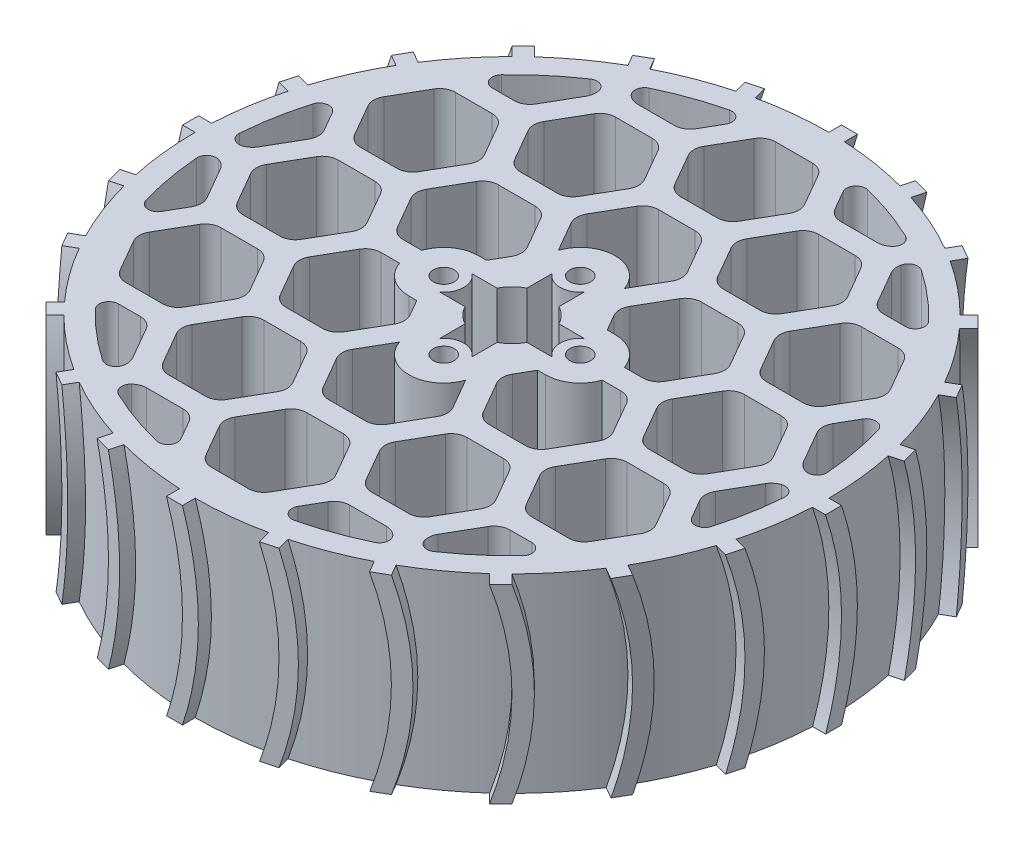
from build123d import *

# Parameters (mm, degrees)
SKETCH3_R           = 100
BOSS_EXTRUDE1_DEPTH = 60
SKETCH3_3_R         = 6.338999989
SKETCH3_3_R_2       = 3.302
BOSS_EXTRUDE2_DEPTH = 60
FILLET2_R           = 3
BOSS_EXTRUDE3_START = -2
BOSS_EXTRUDE3_DEPTH = 6
CIRPATTERN1_COUNT   = 24
SKETCH3_4_R         = 6.338999989
SKETCH3_4_R_2       = 3.302
CUT_EXTRUDE1_DEPTH  = 30


with BuildPart() as part:
    # Sketch3 → Boss-Extrude1 (new body)
    with BuildSketch(Plane(origin=(0, 0, 0), x_dir=(1, 0, 0), z_dir=(0, 1, 0))):
        Circle(SKETCH3_R)
        with BuildLine():
            Line((9.767988863, 5.058299474), (17.727459802, 5.058299474))
            ThreePointArc((17.72745979, 5.05829949), (27.886999941, 1.2e-08), (17.727459809, -5.058299505))
            Line((17.727459783, -5.05829954), (9.767988829, -5.05829954))
            ThreePointArc((9.767988829, -5.05829954), (7.778174567, -7.778174619), (5.058299474, -9.767988863))
            Line((5.058299474, -9.767988863), (5.058299474, -17.727459802))
            ThreePointArc((5.05829949, -17.72745979), (1.2e-08, -27.886999941), (-5.058299505, -17.727459809))
            Line((-5.05829954, -17.727459783), (-5.05829954, -9.767988829))
            ThreePointArc((-5.05829954, -9.767988829), (-7.778174619, -7.778174567), (-9.767988863, -5.058299474))
            Line((-9.767988863, -5.058299474), (-17.727459802, -5.058299474))
            ThreePointArc((-17.72745979, -5.05829949), (-27.886999941, -1.2e-08), (-17.727459809, 5.058299505))
            Line((-17.727459783, 5.05829954), (-9.767988829, 5.05829954))
            ThreePointArc((-9.767988829, 5.05829954), (-7.778174567, 7.778174619), (-5.058299474, 9.767988863))
            Line((-5.058299474, 9.767988863), (-5.058299474, 17.727459802))
            ThreePointArc((-5.05829949, 17.72745979), (-1.2e-08, 27.886999941), (5.058299505, 17.727459809))
            Line((5.05829954, 17.727459783), (5.05829954, 9.767988829))
            ThreePointArc((5.05829954, 9.767988829), (7.778174619, 7.778174567), (9.767988863, 5.058299474))
        make_face(mode=Mode.SUBTRACT)
        with BuildLine():
            ThreePointArc((10.425269447, 25.057096364), (-7e-09, 32.547999916), (-10.425269391, 25.057096268))
            Line((-10.425269391, 25.057096268), (-15.877132403, 34.5))
            ThreePointArc((-15.877132403, 34.5), (-16.547005384, 37), (-15.877132403, 39.5))
            Line((-15.877132403, 39.5), (-10.103629711, 49.5))
            ThreePointArc((-10.103629711, 49.5), (-8.273502692, 51.330127019), (-5.773502692, 52))
            Line((-5.773502692, 52), (5.773502692, 52))
            ThreePointArc((5.773502692, 52), (8.273502692, 51.330127019), (10.103629711, 49.5))
            Line((10.103629711, 49.5), (15.877132403, 39.5))
            ThreePointArc((15.877132403, 39.5), (16.547005384, 37), (15.877132403, 34.5))
            Line((15.877132403, 34.5), (10.425269447, 25.057096364))
        make_face(mode=Mode.SUBTRACT)
        with BuildLine():
            ThreePointArc((86.025190109, 31), (86.543723708, 31.736009208), (87.185842375, 32.367095782))
            ThreePointArc((87.185842375, 32.367095782), (91.209249511, 18.162400823), (92.934116448, 3.5))
            Line((92.934116448, 3.5), (90.355317128, 3.5))
            ThreePointArc((90.355317128, 3.5), (87.855317128, 4.169872981), (86.025190109, 6))
            Line((86.025190109, 6), (80.251687417, 16))
            ThreePointArc((80.251687417, 16), (79.581814436, 18.5), (80.251687417, 21))
            Line((80.251687417, 21), (86.025190109, 31))
        make_face(mode=Mode.SUBTRACT)
        with BuildLine():
            Line((90.355317128, -3.5), (92.934116448, -3.5))
            ThreePointArc((92.934116448, -3.5), (91.209249511, -18.162400823), (87.185842375, -32.367095782))
            ThreePointArc((87.185842375, -32.367095782), (86.543723707, -31.736009208), (86.025190109, -31))
            Line((86.025190109, -31), (80.251687417, -21))
            ThreePointArc((80.251687417, -21), (79.581814436, -18.5), (80.251687417, -16))
            Line((80.251687417, -16), (86.025190109, -6))
            ThreePointArc((86.025190109, -6), (87.855317128, -4.169872981), (90.355317128, -3.5))
        make_face(mode=Mode.SUBTRACT)
        with BuildLine():
            ThreePointArc((69.859382572, -59), (70.756052043, -59.081058665), (71.623648382, -59.321606456))
            ThreePointArc((71.623648382, -59.321606456), (61.333725262, -69.908326725), (49.498147137, -78.733305722))
            Line((49.498147137, -78.733305722), (48.208747477, -76.5))
            ThreePointArc((48.208747477, -76.5), (47.538874496, -74), (48.208747477, -71.5))
            Line((48.208747477, -71.5), (53.982250169, -61.5))
            ThreePointArc((53.982250169, -61.5), (55.812377188, -59.669872981), (58.312377188, -59))
            Line((58.312377188, -59), (69.859382572, -59))
        make_face(mode=Mode.SUBTRACT)
        with BuildLine():
            Line((42.146569651, -80), (43.435969311, -82.233305722))
            ThreePointArc((43.435969311, -82.233305722), (29.875524249, -88.070727548), (15.562193993, -91.688702238))
            ThreePointArc((15.562193993, -91.688702238), (15.787671665, -90.817067873), (16.165807537, -90))
            Line((16.165807537, -90), (21.939310229, -80))
            ThreePointArc((21.939310229, -80), (23.769437248, -78.169872981), (26.269437248, -77.5))
            Line((26.269437248, -77.5), (37.816442632, -77.5))
            ThreePointArc((37.816442632, -77.5), (40.316442632, -78.169872981), (42.146569651, -80))
        make_face(mode=Mode.SUBTRACT)
        with BuildLine():
            ThreePointArc((-16.165807537, -90), (-15.787671665, -90.817067873), (-15.562193993, -91.688702238))
            ThreePointArc((-15.562193993, -91.688702238), (-29.875524249, -88.070727548), (-43.435969311, -82.233305722))
            Line((-43.435969311, -82.233305722), (-42.146569651, -80))
            ThreePointArc((-42.146569651, -80), (-40.316442632, -78.169872981), (-37.816442632, -77.5))
            Line((-37.816442632, -77.5), (-26.269437248, -77.5))
            ThreePointArc((-26.269437248, -77.5), (-23.769437248, -78.169872981), (-21.939310229, -80))
            Line((-21.939310229, -80), (-16.165807537, -90))
        make_face(mode=Mode.SUBTRACT)
        with BuildLine():
            Line((-48.208747477, -76.5), (-49.498147137, -78.733305722))
            ThreePointArc((-49.498147137, -78.733305722), (-61.333725262, -69.908326725), (-71.623648382, -59.321606456))
            ThreePointArc((-71.623648382, -59.321606456), (-70.756052043, -59.081058665), (-69.859382572, -59))
            Line((-69.859382572, -59), (-58.312377188, -59))
            ThreePointArc((-58.312377188, -59), (-55.812377188, -59.669872981), (-53.982250169, -61.5))
            Line((-53.982250169, -61.5), (-48.208747477, -71.5))
            ThreePointArc((-48.208747477, -71.5), (-47.538874496, -74), (-48.208747477, -76.5))
        make_face(mode=Mode.SUBTRACT)
        with BuildLine():
            ThreePointArc((-86.025190109, -31), (-86.543723708, -31.736009208), (-87.185842375, -32.367095782))
            ThreePointArc((-87.185842375, -32.367095782), (-91.209249511, -18.162400823), (-92.934116448, -3.5))
            Line((-92.934116448, -3.5), (-90.355317128, -3.5))
            ThreePointArc((-90.355317128, -3.5), (-87.855317128, -4.169872981), (-86.025190109, -6))
            Line((-86.025190109, -6), (-80.251687417, -16))
            ThreePointArc((-80.251687417, -16), (-79.581814436, -18.5), (-80.251687417, -21))
            Line((-80.251687417, -21), (-86.025190109, -31))
        make_face(mode=Mode.SUBTRACT)
        with BuildLine():
            Line((-90.355317128, 3.5), (-92.934116448, 3.5))
            ThreePointArc((-92.934116448, 3.5), (-91.209249511, 18.162400823), (-87.185842375, 32.367095782))
            ThreePointArc((-87.185842375, 32.367095782), (-86.543723707, 31.736009208), (-86.025190109, 31))
            Line((-86.025190109, 31), (-80.251687417, 21))
            ThreePointArc((-80.251687417, 21), (-79.581814436, 18.5), (-80.251687417, 16))
            Line((-80.251687417, 16), (-86.025190109, 6))
            ThreePointArc((-86.025190109, 6), (-87.855317128, 4.169872981), (-90.355317128, 3.5))
        make_face(mode=Mode.SUBTRACT)
        with BuildLine():
            ThreePointArc((-69.859382572, 59), (-70.756052043, 59.081058665), (-71.623648382, 59.321606456))
            ThreePointArc((-71.623648382, 59.321606456), (-61.333725262, 69.908326725), (-49.498147137, 78.733305722))
            Line((-49.498147137, 78.733305722), (-48.208747477, 76.5))
            ThreePointArc((-48.208747477, 76.5), (-47.538874496, 74), (-48.208747477, 71.5))
            Line((-48.208747477, 71.5), (-53.982250169, 61.5))
            ThreePointArc((-53.982250169, 61.5), (-55.812377188, 59.669872981), (-58.312377188, 59))
            Line((-58.312377188, 59), (-69.859382572, 59))
        make_face(mode=Mode.SUBTRACT)
        with BuildLine():
            Line((-42.146569651, 80), (-43.435969311, 82.233305722))
            ThreePointArc((-43.435969311, 82.233305722), (-29.875524249, 88.070727548), (-15.562193993, 91.688702238))
            ThreePointArc((-15.562193993, 91.688702238), (-15.787671665, 90.817067873), (-16.165807537, 90))
            Line((-16.165807537, 90), (-21.939310229, 80))
            ThreePointArc((-21.939310229, 80), (-23.769437248, 78.169872981), (-26.269437248, 77.5))
            Line((-26.269437248, 77.5), (-37.816442632, 77.5))
            ThreePointArc((-37.816442632, 77.5), (-40.316442632, 78.169872981), (-42.146569651, 80))
        make_face(mode=Mode.SUBTRACT)
        with BuildLine():
            ThreePointArc((16.165807537, 90), (15.787671665, 90.817067873), (15.562193993, 91.688702238))
            ThreePointArc((15.562193993, 91.688702238), (29.875524249, 88.070727548), (43.435969311, 82.233305722))
            Line((43.435969311, 82.233305722), (42.146569651, 80))
            ThreePointArc((42.146569651, 80), (40.316442632, 78.169872981), (37.816442632, 77.5))
            Line((37.816442632, 77.5), (26.269437248, 77.5))
            ThreePointArc((26.269437248, 77.5), (23.769437248, 78.169872981), (21.939310229, 80))
            Line((21.939310229, 80), (16.165807537, 90))
        make_face(mode=Mode.SUBTRACT)
        with BuildLine():
            Line((48.208747477, 76.5), (49.498147137, 78.733305722))
            ThreePointArc((49.498147137, 78.733305722), (61.333725262, 69.908326725), (71.623648382, 59.321606456))
            ThreePointArc((71.623648382, 59.321606456), (70.756052043, 59.081058665), (69.859382572, 59))
            Line((69.859382572, 59), (58.312377188, 59))
            ThreePointArc((58.312377188, 59), (55.812377188, 59.669872981), (53.982250169, 61.5))
            Line((53.982250169, 61.5), (48.208747477, 71.5))
            ThreePointArc((48.208747477, 71.5), (47.538874496, 74), (48.208747477, 76.5))
        make_face(mode=Mode.SUBTRACT)
        with BuildLine():
            Line((-26.269437248, -70.5), (-37.816442632, -70.5))
            ThreePointArc((-37.816442632, -70.5), (-40.316442632, -69.830127019), (-42.146569651, -68))
            Line((-42.146569651, -68), (-47.920072343, -58))
            ThreePointArc((-47.920072343, -58), (-48.589945324, -55.5), (-47.920072343, -53))
            Line((-47.920072343, -53), (-42.146569651, -43))
            ThreePointArc((-42.146569651, -43), (-40.316442632, -41.169872981), (-37.816442632, -40.5))
            Line((-37.816442632, -40.5), (-26.269437248, -40.5))
            ThreePointArc((-26.269437248, -40.5), (-23.769437248, -41.169872981), (-21.939310229, -43))
            Line((-21.939310229, -43), (-16.165807537, -53))
            ThreePointArc((-16.165807537, -53), (-15.495934556, -55.5), (-16.165807537, -58))
            Line((-16.165807537, -58), (-21.939310229, -68))
            ThreePointArc((-21.939310229, -68), (-23.769437248, -69.830127019), (-26.269437248, -70.5))
        make_face(mode=Mode.SUBTRACT)
        with BuildLine():
            Line((15.877132403, -76.5), (10.103629711, -86.5))
            ThreePointArc((10.103629711, -86.5), (8.273502692, -88.330127019), (5.773502692, -89))
            Line((5.773502692, -89), (-5.773502692, -89))
            ThreePointArc((-5.773502692, -89), (-8.273502692, -88.330127019), (-10.103629711, -86.5))
            Line((-10.103629711, -86.5), (-15.877132403, -76.5))
            ThreePointArc((-15.877132403, -76.5), (-16.547005384, -74), (-15.877132403, -71.5))
            Line((-15.877132403, -71.5), (-10.103629711, -61.5))
            ThreePointArc((-10.103629711, -61.5), (-8.273502692, -59.669872981), (-5.773502692, -59))
            Line((-5.773502692, -59), (5.773502692, -59))
            ThreePointArc((5.773502692, -59), (8.273502692, -59.669872981), (10.103629711, -61.5))
            Line((10.103629711, -61.5), (15.877132403, -71.5))
            ThreePointArc((15.877132403, -71.5), (16.547005384, -74), (15.877132403, -76.5))
        make_face(mode=Mode.SUBTRACT)
        with BuildLine():
            Line((-58.312377188, -52), (-69.859382572, -52))
            ThreePointArc((-69.859382572, -52), (-72.359382572, -51.330127019), (-74.189509591, -49.5))
            Line((-74.189509591, -49.5), (-79.963012283, -39.5))
            ThreePointArc((-79.963012283, -39.5), (-80.632885264, -37), (-79.963012283, -34.5))
            Line((-79.963012283, -34.5), (-74.189509591, -24.5))
            ThreePointArc((-74.189509591, -24.5), (-72.359382572, -22.669872981), (-69.859382572, -22))
            Line((-69.859382572, -22), (-58.312377188, -22))
            ThreePointArc((-58.312377188, -22), (-55.812377188, -22.669872981), (-53.982250169, -24.5))
            Line((-53.982250169, -24.5), (-48.208747477, -34.5))
            ThreePointArc((-48.208747477, -34.5), (-47.538874496, -37), (-48.208747477, -39.5))
            Line((-48.208747477, -39.5), (-53.982250169, -49.5))
            ThreePointArc((-53.982250169, -49.5), (-55.812377188, -51.330127019), (-58.312377188, -52))
        make_face(mode=Mode.SUBTRACT)
        with BuildLine():
            Line((-74.189509591, -12.5), (-79.963012283, -2.5))
            ThreePointArc((-79.963012283, -2.5), (-80.632885264, 0), (-79.963012283, 2.5))
            Line((-79.963012283, 2.5), (-74.189509591, 12.5))
            ThreePointArc((-74.189509591, 12.5), (-72.359382572, 14.330127019), (-69.859382572, 15))
            Line((-69.859382572, 15), (-58.312377188, 15))
            ThreePointArc((-58.312377188, 15), (-55.812377188, 14.330127019), (-53.982250169, 12.5))
            Line((-53.982250169, 12.5), (-48.208747477, 2.5))
            ThreePointArc((-48.208747477, 2.5), (-47.538874496, 0), (-48.208747477, -2.5))
            Line((-48.208747477, -2.5), (-53.982250169, -12.5))
            ThreePointArc((-53.982250169, -12.5), (-55.812377188, -14.330127019), (-58.312377188, -15))
            Line((-58.312377188, -15), (-69.859382572, -15))
            ThreePointArc((-69.859382572, -15), (-72.359382572, -14.330127019), (-74.189509591, -12.5))
        make_face(mode=Mode.SUBTRACT)
        with BuildLine():
            Line((47.920072343, -58), (42.146569651, -68))
            ThreePointArc((42.146569651, -68), (40.316442632, -69.830127019), (37.816442632, -70.5))
            Line((37.816442632, -70.5), (26.269437248, -70.5))
            ThreePointArc((26.269437248, -70.5), (23.769437248, -69.830127019), (21.939310229, -68))
            Line((21.939310229, -68), (16.165807537, -58))
            ThreePointArc((16.165807537, -58), (15.495934556, -55.5), (16.165807537, -53))
            Line((16.165807537, -53), (21.939310229, -43))
            ThreePointArc((21.939310229, -43), (23.769437248, -41.169872981), (26.269437248, -40.5))
            Line((26.269437248, -40.5), (37.816442632, -40.5))
            ThreePointArc((37.816442632, -40.5), (40.316442632, -41.169872981), (42.146569651, -43))
            Line((42.146569651, -43), (47.920072343, -53))
            ThreePointArc((47.920072343, -53), (48.589945324, -55.5), (47.920072343, -58))
        make_face(mode=Mode.SUBTRACT)
        with BuildLine():
            ThreePointArc((79.963012283, 39.5), (80.632885264, 37), (79.963012283, 34.5))
            Line((79.963012283, 34.5), (74.189509591, 24.5))
            ThreePointArc((74.189509591, 24.5), (72.359382572, 22.669872981), (69.859382572, 22))
            Line((69.859382572, 22), (58.312377188, 22))
            ThreePointArc((58.312377188, 22), (55.812377188, 22.669872981), (53.982250169, 24.5))
            Line((53.982250169, 24.5), (48.208747477, 34.5))
            ThreePointArc((48.208747477, 34.5), (47.538874496, 37), (48.208747477, 39.5))
            Line((48.208747477, 39.5), (53.982250169, 49.5))
            ThreePointArc((53.982250169, 49.5), (55.812377188, 51.330127019), (58.312377188, 52))
            Line((58.312377188, 52), (69.859382572, 52))
            ThreePointArc((69.859382572, 52), (72.359382572, 51.330127019), (74.189509591, 49.5))
            Line((74.189509591, 49.5), (79.963012283, 39.5))
        make_face(mode=Mode.SUBTRACT)
        with BuildLine():
            Line((-16.165807537, 16), (-19.052558858, 11.000000044))
            Line((-19.052558858, 11.000000044), (-21.547999916, 11.000000044))
            ThreePointArc((-21.547999916, 11.000000044), (-27.970616224, 8.93028558), (-31.976326738, 3.5))
            Line((-31.976326738, 3.5), (-37.816442632, 3.5))
            ThreePointArc((-37.816442632, 3.5), (-40.316442632, 4.169872981), (-42.146569651, 6))
            Line((-42.146569651, 6), (-47.920072343, 16))
            ThreePointArc((-47.920072343, 16), (-48.589945324, 18.5), (-47.920072343, 21))
            Line((-47.920072343, 21), (-42.146569651, 31))
            ThreePointArc((-42.146569651, 31), (-40.316442632, 32.830127019), (-37.816442632, 33.5))
            Line((-37.816442632, 33.5), (-26.269437248, 33.5))
            ThreePointArc((-26.269437248, 33.5), (-23.769437248, 32.830127019), (-21.939310229, 31))
            Line((-21.939310229, 31), (-16.165807537, 21))
            ThreePointArc((-16.165807537, 21), (-15.495934556, 18.5), (-16.165807537, 16))
        make_face(mode=Mode.SUBTRACT)
        with BuildLine():
            Line((-37.816442632, -3.5), (-31.976326709, -3.5))
            ThreePointArc((-31.976326709, -3.5), (-27.970616186, -8.930285519), (-21.547999916, -10.999999956))
            Line((-21.547999916, -10.999999956), (-19.052558909, -10.999999956))
            Line((-19.052558909, -10.999999956), (-16.165807537, -16))
            ThreePointArc((-16.165807537, -16), (-15.495934556, -18.5), (-16.165807537, -21))
            Line((-16.165807537, -21), (-21.939310229, -31))
            ThreePointArc((-21.939310229, -31), (-23.769437248, -32.830127019), (-26.269437248, -33.5))
            Line((-26.269437248, -33.5), (-37.816442632, -33.5))
            ThreePointArc((-37.816442632, -33.5), (-40.316442632, -32.830127019), (-42.146569651, -31))
            Line((-42.146569651, -31), (-47.920072343, -21))
            ThreePointArc((-47.920072343, -21), (-48.589945324, -18.5), (-47.920072343, -16))
            Line((-47.920072343, -16), (-42.146569651, -6))
            ThreePointArc((-42.146569651, -6), (-40.316442632, -4.169872981), (-37.816442632, -3.5))
        make_face(mode=Mode.SUBTRACT)
        with BuildLine():
            Line((-15.877132403, -34.5), (-10.425269447, -25.057096364))
            ThreePointArc((-10.425269447, -25.057096364), (7e-09, -32.547999916), (10.425269391, -25.057096268))
            Line((10.425269391, -25.057096268), (15.877132403, -34.5))
            ThreePointArc((15.877132403, -34.5), (16.547005384, -37), (15.877132403, -39.5))
            Line((15.877132403, -39.5), (10.103629711, -49.5))
            ThreePointArc((10.103629711, -49.5), (8.273502692, -51.330127019), (5.773502692, -52))
            Line((5.773502692, -52), (-5.773502692, -52))
            ThreePointArc((-5.773502692, -52), (-8.273502692, -51.330127019), (-10.103629711, -49.5))
            Line((-10.103629711, -49.5), (-15.877132403, -39.5))
            ThreePointArc((-15.877132403, -39.5), (-16.547005384, -37), (-15.877132403, -34.5))
        make_face(mode=Mode.SUBTRACT)
        with BuildLine():
            Line((16.165807537, -16), (19.052558858, -11.000000044))
            Line((19.052558858, -11.000000044), (21.547999916, -11.000000044))
            ThreePointArc((21.547999916, -11.000000044), (27.970616224, -8.93028558), (31.976326738, -3.5))
            Line((31.976326738, -3.5), (37.816442632, -3.5))
            ThreePointArc((37.816442632, -3.5), (40.316442632, -4.169872981), (42.146569651, -6))
            Line((42.146569651, -6), (47.920072343, -16))
            ThreePointArc((47.920072343, -16), (48.589945324, -18.5), (47.920072343, -21))
            Line((47.920072343, -21), (42.146569651, -31))
            ThreePointArc((42.146569651, -31), (40.316442632, -32.830127019), (37.816442632, -33.5))
            Line((37.816442632, -33.5), (26.269437248, -33.5))
            ThreePointArc((26.269437248, -33.5), (23.769437248, -32.830127019), (21.939310229, -31))
            Line((21.939310229, -31), (16.165807537, -21))
            ThreePointArc((16.165807537, -21), (15.495934556, -18.5), (16.165807537, -16))
        make_face(mode=Mode.SUBTRACT)
        with BuildLine():
            Line((37.816442632, 3.5), (31.976326709, 3.5))
            ThreePointArc((31.976326709, 3.5), (27.970616186, 8.930285519), (21.547999916, 10.999999956))
            Line((21.547999916, 10.999999956), (19.052558909, 10.999999956))
            Line((19.052558909, 10.999999956), (16.165807537, 16))
            ThreePointArc((16.165807537, 16), (15.495934556, 18.5), (16.165807537, 21))
            Line((16.165807537, 21), (21.939310229, 31))
            ThreePointArc((21.939310229, 31), (23.769437248, 32.830127019), (26.269437248, 33.5))
            Line((26.269437248, 33.5), (37.816442632, 33.5))
            ThreePointArc((37.816442632, 33.5), (40.316442632, 32.830127019), (42.146569651, 31))
            Line((42.146569651, 31), (47.920072343, 21))
            ThreePointArc((47.920072343, 21), (48.589945324, 18.5), (47.920072343, 16))
            Line((47.920072343, 16), (42.146569651, 6))
            ThreePointArc((42.146569651, 6), (40.316442632, 4.169872981), (37.816442632, 3.5))
        make_face(mode=Mode.SUBTRACT)
        with BuildLine():
            Line((74.189509591, -24.5), (79.963012283, -34.5))
            ThreePointArc((79.963012283, -34.5), (80.632885264, -37), (79.963012283, -39.5))
            Line((79.963012283, -39.5), (74.189509591, -49.5))
            ThreePointArc((74.189509591, -49.5), (72.359382572, -51.330127019), (69.859382572, -52))
            Line((69.859382572, -52), (58.312377188, -52))
            ThreePointArc((58.312377188, -52), (55.812377188, -51.330127019), (53.982250169, -49.5))
            Line((53.982250169, -49.5), (48.208747477, -39.5))
            ThreePointArc((48.208747477, -39.5), (47.538874496, -37), (48.208747477, -34.5))
            Line((48.208747477, -34.5), (53.982250169, -24.5))
            ThreePointArc((53.982250169, -24.5), (55.812377188, -22.669872981), (58.312377188, -22))
            Line((58.312377188, -22), (69.859382572, -22))
            ThreePointArc((69.859382572, -22), (72.359382572, -22.669872981), (74.189509591, -24.5))
        make_face(mode=Mode.SUBTRACT)
        with BuildLine():
            Line((74.189509591, 12.5), (79.963012283, 2.5))
            ThreePointArc((79.963012283, 2.5), (80.632885264, 0), (79.963012283, -2.5))
            Line((79.963012283, -2.5), (74.189509591, -12.5))
            ThreePointArc((74.189509591, -12.5), (72.359382572, -14.330127019), (69.859382572, -15))
            Line((69.859382572, -15), (58.312377188, -15))
            ThreePointArc((58.312377188, -15), (55.812377188, -14.330127019), (53.982250169, -12.5))
            Line((53.982250169, -12.5), (48.208747477, -2.5))
            ThreePointArc((48.208747477, -2.5), (47.538874496, 0), (48.208747477, 2.5))
            Line((48.208747477, 2.5), (53.982250169, 12.5))
            ThreePointArc((53.982250169, 12.5), (55.812377188, 14.330127019), (58.312377188, 15))
            Line((58.312377188, 15), (69.859382572, 15))
            ThreePointArc((69.859382572, 15), (72.359382572, 14.330127019), (74.189509591, 12.5))
        make_face(mode=Mode.SUBTRACT)
        with BuildLine():
            Line((-74.189509591, 24.5), (-79.963012283, 34.5))
            ThreePointArc((-79.963012283, 34.5), (-80.632885264, 37), (-79.963012283, 39.5))
            Line((-79.963012283, 39.5), (-74.189509591, 49.5))
            ThreePointArc((-74.189509591, 49.5), (-72.359382572, 51.330127019), (-69.859382572, 52))
            Line((-69.859382572, 52), (-58.312377188, 52))
            ThreePointArc((-58.312377188, 52), (-55.812377188, 51.330127019), (-53.982250169, 49.5))
            Line((-53.982250169, 49.5), (-48.208747477, 39.5))
            ThreePointArc((-48.208747477, 39.5), (-47.538874496, 37), (-48.208747477, 34.5))
            Line((-48.208747477, 34.5), (-53.982250169, 24.5))
            ThreePointArc((-53.982250169, 24.5), (-55.812377188, 22.669872981), (-58.312377188, 22))
            Line((-58.312377188, 22), (-69.859382572, 22))
            ThreePointArc((-69.859382572, 22), (-72.359382572, 22.669872981), (-74.189509591, 24.5))
        make_face(mode=Mode.SUBTRACT)
        with BuildLine():
            Line((-47.920072343, 58), (-42.146569651, 68))
            ThreePointArc((-42.146569651, 68), (-40.316442632, 69.830127019), (-37.816442632, 70.5))
            Line((-37.816442632, 70.5), (-26.269437248, 70.5))
            ThreePointArc((-26.269437248, 70.5), (-23.769437248, 69.830127019), (-21.939310229, 68))
            Line((-21.939310229, 68), (-16.165807537, 58))
            ThreePointArc((-16.165807537, 58), (-15.495934556, 55.5), (-16.165807537, 53))
            Line((-16.165807537, 53), (-21.939310229, 43))
            ThreePointArc((-21.939310229, 43), (-23.769437248, 41.169872981), (-26.269437248, 40.5))
            Line((-26.269437248, 40.5), (-37.816442632, 40.5))
            ThreePointArc((-37.816442632, 40.5), (-40.316442632, 41.169872981), (-42.146569651, 43))
            Line((-42.146569651, 43), (-47.920072343, 53))
            ThreePointArc((-47.920072343, 53), (-48.589945324, 55.5), (-47.920072343, 58))
        make_face(mode=Mode.SUBTRACT)
        with BuildLine():
            Line((26.269437248, 70.5), (37.816442632, 70.5))
            ThreePointArc((37.816442632, 70.5), (40.316442632, 69.830127019), (42.146569651, 68))
            Line((42.146569651, 68), (47.920072343, 58))
            ThreePointArc((47.920072343, 58), (48.589945324, 55.5), (47.920072343, 53))
            Line((47.920072343, 53), (42.146569651, 43))
            ThreePointArc((42.146569651, 43), (40.316442632, 41.169872981), (37.816442632, 40.5))
            Line((37.816442632, 40.5), (26.269437248, 40.5))
            ThreePointArc((26.269437248, 40.5), (23.769437248, 41.169872981), (21.939310229, 43))
            Line((21.939310229, 43), (16.165807537, 53))
            ThreePointArc((16.165807537, 53), (15.495934556, 55.5), (16.165807537, 58))
            Line((16.165807537, 58), (21.939310229, 68))
            ThreePointArc((21.939310229, 68), (23.769437248, 69.830127019), (26.269437248, 70.5))
        make_face(mode=Mode.SUBTRACT)
        with BuildLine():
            Line((-5.773502692, 89), (5.773502692, 89))
            ThreePointArc((5.773502692, 89), (8.273502692, 88.330127019), (10.103629711, 86.5))
            Line((10.103629711, 86.5), (15.877132403, 76.5))
            ThreePointArc((15.877132403, 76.5), (16.547005384, 74), (15.877132403, 71.5))
            Line((15.877132403, 71.5), (10.103629711, 61.5))
            ThreePointArc((10.103629711, 61.5), (8.273502692, 59.669872981), (5.773502692, 59))
            Line((5.773502692, 59), (-5.773502692, 59))
            ThreePointArc((-5.773502692, 59), (-8.273502692, 59.669872981), (-10.103629711, 61.5))
            Line((-10.103629711, 61.5), (-15.877132403, 71.5))
            ThreePointArc((-15.877132403, 71.5), (-16.547005384, 74), (-15.877132403, 76.5))
            Line((-15.877132403, 76.5), (-10.103629711, 86.5))
            ThreePointArc((-10.103629711, 86.5), (-8.273502692, 88.330127019), (-5.773502692, 89))
        make_face(mode=Mode.SUBTRACT)
    extrude(amount=BOSS_EXTRUDE1_DEPTH)

    # Sketch3<3> → Boss-Extrude2 (add)
    # profile 1 of 4: a face of its own
    with BuildSketch(Plane(origin=(0, 0, 0), x_dir=(1, 0, 0), z_dir=(0, 1, 0))):
        with Locations((0, 21.547999952)):
            Circle(SKETCH3_3_R)
        with Locations((4.4e-08, 21.547999942)):
            Circle(SKETCH3_3_R_2, mode=Mode.SUBTRACT)
    # profile 2 of 4: a face of its own
    with BuildSketch(Plane(origin=(0, 0, 0), x_dir=(1, 0, 0), z_dir=(0, 1, 0))):
        with Locations((21.547999952, 0)):
            Circle(SKETCH3_3_R)
        with Locations((21.547999942, -4.4e-08)):
            Circle(SKETCH3_3_R_2, mode=Mode.SUBTRACT)
    # profile 3 of 4: a face of its own
    with BuildSketch(Plane(origin=(0, 0, 0), x_dir=(1, 0, 0), z_dir=(0, 1, 0))):
        with Locations((-21.547999952, 0)):
            Circle(SKETCH3_3_R)
        with Locations((-21.547999942, 4.4e-08)):
            Circle(SKETCH3_3_R_2, mode=Mode.SUBTRACT)
    # profile 4 of 4: a face of its own
    with BuildSketch(Plane(origin=(0, 0, 0), x_dir=(1, 0, 0), z_dir=(0, 1, 0))):
        with Locations((0, -21.547999952)):
            Circle(SKETCH3_3_R)
        with Locations((-4.4e-08, -21.547999942)):
            Circle(SKETCH3_3_R_2, mode=Mode.SUBTRACT)
    extrude(amount=BOSS_EXTRUDE2_DEPTH)

    # Fillet2
    fillet2_edges = [part.edges().sort_by_distance(p)[0] for p in [
        (92.934116448, 30, -3.5),
        (87.185842375, 30, -32.367095782),
        (92.934116448, 30, 3.5),
        (87.185842375, 30, 32.367095782),
        (71.623648382, 30, 59.321606456),
        (49.498147137, 30, 78.733305722),
        (43.435969311, 30, 82.233305722),
        (15.562193993, 30, 91.688702238),
        (-15.562193993, 30, 91.688702238),
        (-43.435969311, 30, 82.233305722),
        (-49.498147137, 30, 78.733305722),
        (-71.623648382, 30, 59.321606456),
        (-87.185842375, 30, 32.367095782),
        (-92.934116448, 30, 3.5),
        (-92.934116448, 30, -3.5),
        (-87.185842375, 30, -32.367095782),
        (-43.435969311, 30, -82.233305722),
        (-49.498147137, 30, -78.733305722),
        (-71.623648382, 30, -59.321606456),
        (-15.562193993, 30, -91.688702238),
        (15.562193993, 30, -91.688702238),
        (43.435969311, 30, -82.233305722),
        (49.498147137, 30, -78.733305722),
        (71.623648382, 30, -59.321606456),
    ]]
    fillet(fillet2_edges, radius=FILLET2_R)

    # Sketch4 → Boss-Extrude3 (add)
    with BuildSketch(Plane(origin=(100, 0, 0), x_dir=(0, 0, -1), z_dir=(1, 0, 0)).offset(BOSS_EXTRUDE3_START)):
        with BuildLine():
            Line((-5, 0), (0, 0))
            add(Edge.make_bspline(
                [(0, 60), (10, 30), (0, 0)],
                knots=[0, 0, 0, 1, 1, 1], degree=2))
            Line((0, 60), (-5.05829954, 60))
            add(Edge.make_bspline(
                [(-5.05829954, 60), (5.029140786, 30.009506083), (-5, 0)],
                knots=[0, 0, 0, 1, 1, 1], degree=2))
        make_face()
    boss_extrude3 = extrude(amount=BOSS_EXTRUDE3_DEPTH)

    # CirPattern1: Boss-Extrude3 ×24 about axis
    cirpattern1_axis = Axis((0, 60, 0), (0, -1, 0))
    for i in range(1, CIRPATTERN1_COUNT):
        add(boss_extrude3.rotate(cirpattern1_axis, i * 360 / CIRPATTERN1_COUNT))

    # Sketch3<4> → Cut-Extrude1 (cut)
    # profile 1 of 4: a face of its own
    with BuildSketch(Plane(origin=(0, 0, 0), x_dir=(1, 0, 0), z_dir=(0, 1, 0))):
        with Locations((0, 21.547999952)):
            Circle(SKETCH3_4_R)
        with Locations((4.4e-08, 21.547999942)):
            Circle(SKETCH3_4_R_2, mode=Mode.SUBTRACT)
    # profile 2 of 4: a face of its own
    with BuildSketch(Plane(origin=(0, 0, 0), x_dir=(1, 0, 0), z_dir=(0, 1, 0))):
        with Locations((21.547999952, 0)):
            Circle(SKETCH3_4_R)
        with Locations((21.547999942, -4.4e-08)):
            Circle(SKETCH3_4_R_2, mode=Mode.SUBTRACT)
    # profile 3 of 4: a face of its own
    with BuildSketch(Plane(origin=(0, 0, 0), x_dir=(1, 0, 0), z_dir=(0, 1, 0))):
        with Locations((-21.547999952, 0)):
            Circle(SKETCH3_4_R)
        with Locations((-21.547999942, 4.4e-08)):
            Circle(SKETCH3_4_R_2, mode=Mode.SUBTRACT)
    # profile 4 of 4: a face of its own
    with BuildSketch(Plane(origin=(0, 0, 0), x_dir=(1, 0, 0), z_dir=(0, 1, 0))):
        with Locations((0, -21.547999952)):
            Circle(SKETCH3_4_R)
        with Locations((-4.4e-08, -21.547999942)):
            Circle(SKETCH3_4_R_2, mode=Mode.SUBTRACT)
    extrude(amount=CUT_EXTRUDE1_DEPTH, mode=Mode.SUBTRACT)


solid = part.part
